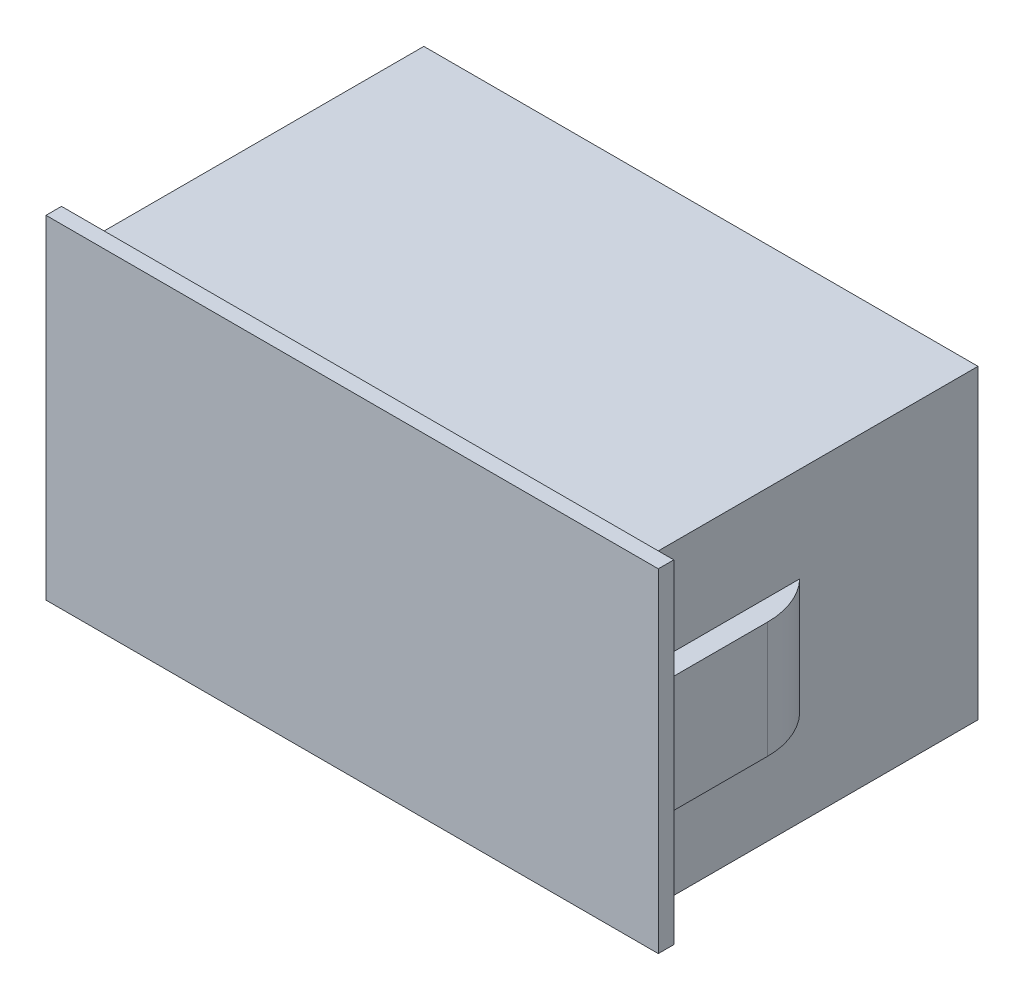
from build123d import *

# Parameters (mm, degrees)
SKIZZE1_W                       = 79
SKIZZE1_H                       = 43
AUFSATZ_LINEAR_AUSTRAGEN1_DEPTH = 45
SKIZZE2_W                       = 79
SKIZZE2_H                       = 43
SKIZZE2_W_2                     = 71.5
SKIZZE2_H_2                     = 39.5
SCHNITT_LINEAR_AUSTRAGEN1_DEPTH = 43
SKIZZE3_W                       = 2.75
SKIZZE3_H                       = 15
AUFSATZ_LINEAR_AUSTRAGEN2_DEPTH = 20
VERRUNDUNG1_R                   = 10


with BuildPart() as part:
    # Skizze1 → Aufsatz-Linear austragen1 (new body)
    with BuildSketch(Plane.XY):
        Rectangle(SKIZZE1_W, SKIZZE1_H)
    extrude(amount=AUFSATZ_LINEAR_AUSTRAGEN1_DEPTH)

    # Skizze2 → Schnitt-Linear austragen1 (cut)
    with BuildSketch(Plane(origin=(0, 0, 0), x_dir=(-1, 0, 0), z_dir=(0, 0, -1))):
        Rectangle(SKIZZE2_W, SKIZZE2_H)
        Rectangle(SKIZZE2_W_2, SKIZZE2_H_2, mode=Mode.SUBTRACT)
    extrude(amount=-SCHNITT_LINEAR_AUSTRAGEN1_DEPTH, mode=Mode.SUBTRACT)

    # Skizze3 → Aufsatz-Linear austragen2 (add)
    with BuildSketch(Plane(origin=(0, 0, 43), x_dir=(-1, 0, 0), z_dir=(0, 0, -1))):
        with Locations((-37.125, 0)):
            Rectangle(SKIZZE3_W, SKIZZE3_H)
        with Locations((37.125, 0)):
            Rectangle(SKIZZE3_W, SKIZZE3_H)
    extrude(amount=AUFSATZ_LINEAR_AUSTRAGEN2_DEPTH)

    # Verrundung1
    # the kernel refuses this fillet: 10 mm, written as the material it takes off along each edge
    with BuildSketch(Plane(origin=(-38.5, 24.718721642, 23), x_dir=(0, 0, 1), z_dir=(0, -1, 0)), Plane(origin=(38.5, -24.718721642, 23), x_dir=(0, 0, 1), z_dir=(0, 1, 0))) as verrundung1_piece_1:
        with BuildLine():
            CenterArc((6.887488657, -10), VERRUNDUNG1_R, 90, 43.531152167)
            Line((0, -2.75), (-0.137749773, -2.605))
            ThreePointArc((-0.137749773, -2.605), (-0.2, -1.375), (-0.2, 0))
            Line((-0.2, 0), (0, 0.2))
            Line((0, 0.2), (6.887488657, 0.2))
            Line((6.887488657, 0.2), (6.887488657, 0))
        make_face()
    extrude(amount=49.437443285, mode=Mode.SUBTRACT)


solid = part.part
